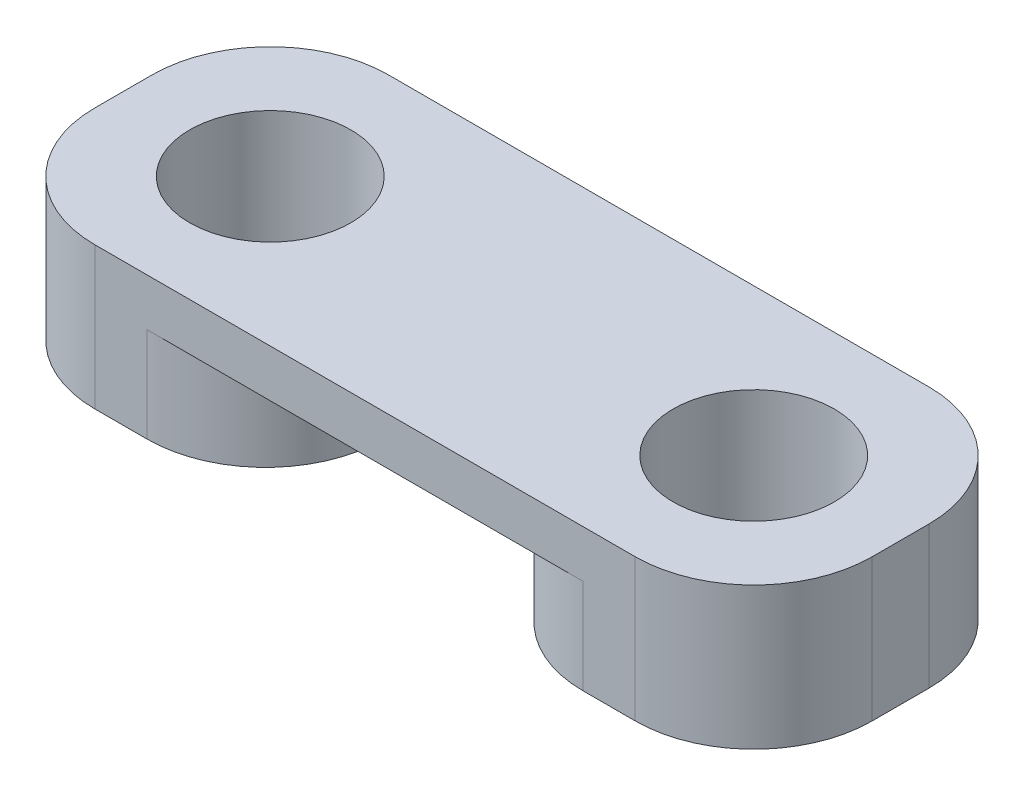
from build123d import *

# Parameters (mm, degrees)
SKETCH1_W           = 16.398039
SKETCH1_H           = 6.2
SKETCH1_R           = 1.7
BOSS_EXTRUDE1_DEPTH = 3
SKETCH5_W           = 4.198039
SKETCH5_H           = 2
CUT_EXTRUDE4_DEPTH  = 11.708124054
FILLET2_R           = 2.5


with BuildPart() as part:
    # Sketch1 → Boss-Extrude1 (new body)
    with BuildSketch(Plane(origin=(0, 0, 0), x_dir=(1, 0, 0), z_dir=(0, 1, 0))):
        with Locations((0, 3.1)):
            Rectangle(SKETCH1_W, SKETCH1_H)
        with Locations((-5.0990195, 3.1)):
            Circle(SKETCH1_R, mode=Mode.SUBTRACT)
        with Locations((5.0990195, 3.1)):
            Circle(SKETCH1_R, mode=Mode.SUBTRACT)
    extrude(amount=BOSS_EXTRUDE1_DEPTH)

    # Sketch5 → Cut-Extrude4 (cut, through all)
    with BuildSketch(Plane.XY):
        with Locations((0, 1)):
            Rectangle(SKETCH5_W, SKETCH5_H)
    extrude(amount=-CUT_EXTRUDE4_DEPTH, mode=Mode.SUBTRACT)

    # Fillet2
    fillet2_edges = [part.edges().sort_by_distance(p)[0] for p in [
        (8.1990195, 1.5, -6.2),
        (8.1990195, 1.5, 0),
        (-8.1990195, 1.5, -6.2),
        (-8.1990195, 1.5, 0),
        (2.0990195, 1, 0),
        (2.0990195, 1, -6.2),
        (-2.0990195, 1, -6.2),
        (-2.0990195, 1, 0),
    ]]
    fillet(fillet2_edges, radius=FILLET2_R)


solid = part.part
